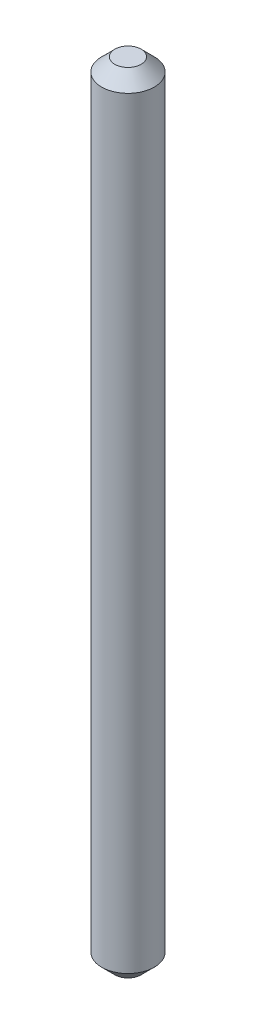
from build123d import *

# Parameters (mm, degrees)
SZKIC1_R                    = 1
DODANIE_WYCI_GNI_CIE1_DEPTH = 15
SFAZOWANIE1_SIZE            = 0.5


with BuildPart() as part:
    # Szkic1 → Dodanie-wyciągnięcie1 (new, symmetric)
    with BuildSketch(Plane(origin=(0, 0, 0), x_dir=(1, 0, 0), z_dir=(0, 1, 0))):
        Circle(SZKIC1_R)
    extrude(amount=DODANIE_WYCI_GNI_CIE1_DEPTH, both=True)

    # Sfazowanie1
    sfazowanie1_edges = [part.edges().sort_by_distance(p)[0] for p in [
        (-1, -15, 0),
        (-1, 15, 0),
    ]]
    chamfer(sfazowanie1_edges, length=SFAZOWANIE1_SIZE)


solid = part.part
